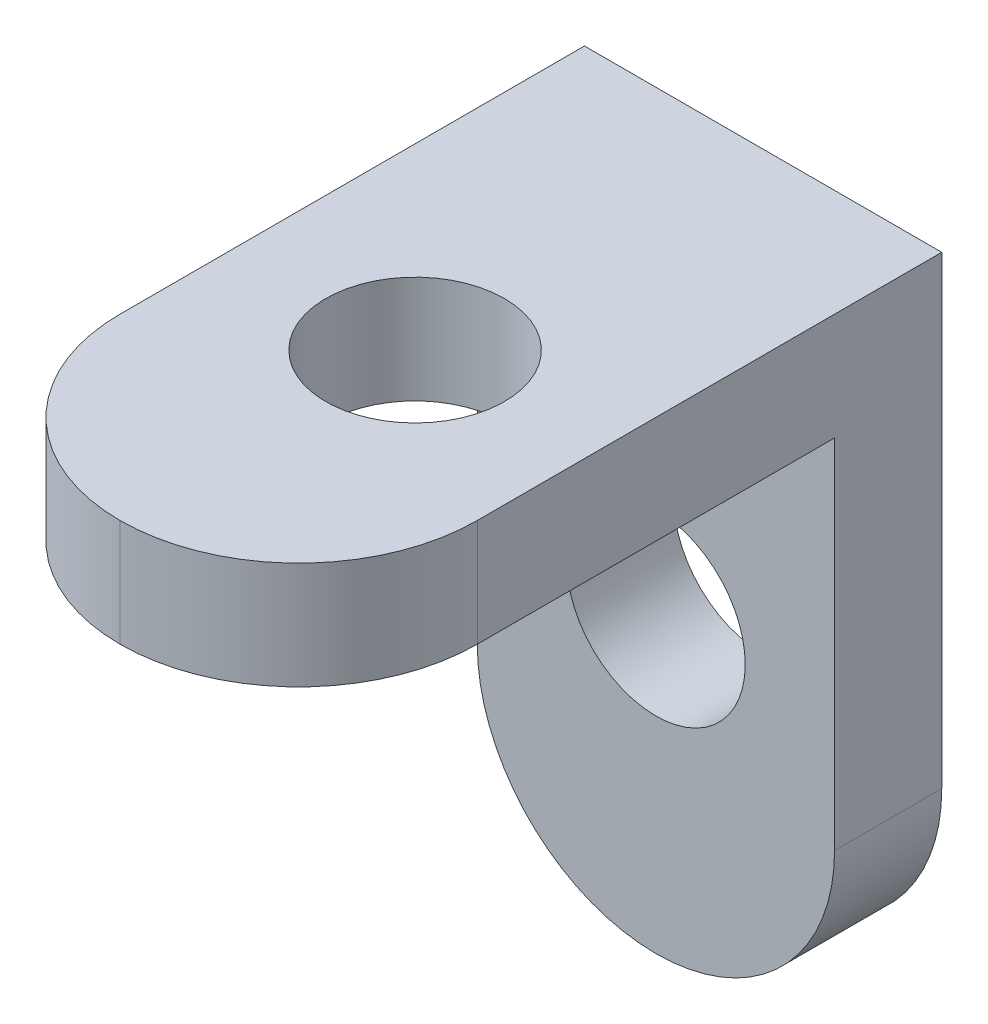
from build123d import *

# Parameters (mm, degrees)
SKETCH_2_W          = 10
SKETCH_2_H          = 18
EXTRUDE_1_DEPTH     = 3
SKETCH_3_R          = 2.5
CUT_EXTRUDE_1_DEPTH = 21.808652047
FILLET_1_R          = 5
SKETCH_4_W          = 10
SKETCH_4_H          = 3
EXTRUDE_2_DEPTH     = 15
FILLET_2_R          = 5
SKETCH_5_R          = 2.5
CUT_EXTRUDE_2_DEPTH = 26.475478406
SKETCH_6_R          = 2.5
EXTRUDE_3_DEPTH     = 3
SKETCH_7_R          = 2.5
CUT_EXTRUDE_3_DEPTH = 26.475478406
SKETCH_8_R          = 2.580933604
EXTRUDE_4_DEPTH     = 3
SKETCH_9_R          = 2.5
CUT_EXTRUDE_4_DEPTH = 26.475478406
SKETCH_10_R         = 2.5
EXTRUDE_5_DEPTH     = 3
SKETCH_11_R         = 2.5
CUT_EXTRUDE_5_DEPTH = 26.475478406


with BuildPart() as part:
    # 草图2 → 凸台-拉伸1 (new body)
    with BuildSketch(Plane.XY):
        with Locations((5, -9)):
            Rectangle(SKETCH_2_W, SKETCH_2_H)
    extrude(amount=EXTRUDE_1_DEPTH)

    # 草图3 → 切除-拉伸1 (cut, through all)
    with BuildSketch(Plane.XY.offset(3)):
        with Locations((5, -9.74)):
            Circle(SKETCH_3_R)
    extrude(amount=-CUT_EXTRUDE_1_DEPTH, mode=Mode.SUBTRACT)

    # 圆角1
    fillet_1_edges = [part.edges().sort_by_distance(p)[0] for p in [
        (10, -18, 1.5),
        (0, -18, 1.5),
    ]]
    fillet(fillet_1_edges, radius=FILLET_1_R - 0.0001)  # a hair under: the kernel refuses the full size

    # 草图4 → 凸台-拉伸2 (add)
    with BuildSketch(Plane.XY.offset(3)):
        with Locations((5, -1.5)):
            Rectangle(SKETCH_4_W, SKETCH_4_H)
    extrude(amount=EXTRUDE_2_DEPTH)

    # 圆角2
    fillet_2_edges = [part.edges().sort_by_distance(p)[0] for p in [
        (10, -1.5, 18),
        (0, -1.5, 18),
    ]]
    fillet(fillet_2_edges, radius=FILLET_2_R - 0.0001)  # a hair under: the kernel refuses the full size

    # 草图5 → 切除-拉伸2 (cut, through all)
    with BuildSketch(Plane.XZ.offset(3)):
        with Locations(Location((5, 11.11, 0), (0, 0, 270))):
            Circle(SKETCH_5_R)
    extrude(amount=-CUT_EXTRUDE_2_DEPTH, mode=Mode.SUBTRACT)

    # 草图6 → 凸台-拉伸3 (add)
    with BuildSketch(Plane.XZ.offset(3)):
        with Locations((5, 11.11)):
            Circle(SKETCH_6_R)
    extrude(amount=-EXTRUDE_3_DEPTH)

    # 草图7 → 切除-拉伸3 (cut, through all)
    with BuildSketch(Plane(origin=(0, -3, 0), x_dir=(-1, 0, 0), z_dir=(0, -1, 0))):
        with Locations(Location((-5, -12.02, 0), (0, 0, 90))):
            Circle(SKETCH_7_R)
    extrude(amount=-CUT_EXTRUDE_3_DEPTH, mode=Mode.SUBTRACT)

    # 草图8 → 凸台-拉伸4 (add)
    with BuildSketch(Plane.XZ.offset(3)):
        with Locations((5, 12.02)):
            Circle(SKETCH_8_R)
    extrude(amount=-EXTRUDE_4_DEPTH)

    # 草图9 → 切除-拉伸4 (cut, through all)
    with BuildSketch(Plane.XZ.offset(3)):
        with Locations(Location((5, 8.11, 0), (0, 0, 270))):
            Circle(SKETCH_9_R)
    extrude(amount=-CUT_EXTRUDE_4_DEPTH, mode=Mode.SUBTRACT)

    # 草图10 → 凸台-拉伸5 (add)
    with BuildSketch(Plane.XZ.offset(3)):
        with Locations((5, 8.11)):
            Circle(SKETCH_10_R)
    extrude(amount=-EXTRUDE_5_DEPTH)

    # 草图11 → 切除-拉伸5 (cut, through all)
    with BuildSketch(Plane.XZ.offset(3)):
        with Locations(Location((5, 9.74, 0), (0, 0, 270))):
            Circle(SKETCH_11_R)
    extrude(amount=-CUT_EXTRUDE_5_DEPTH, mode=Mode.SUBTRACT)


solid = part.part
